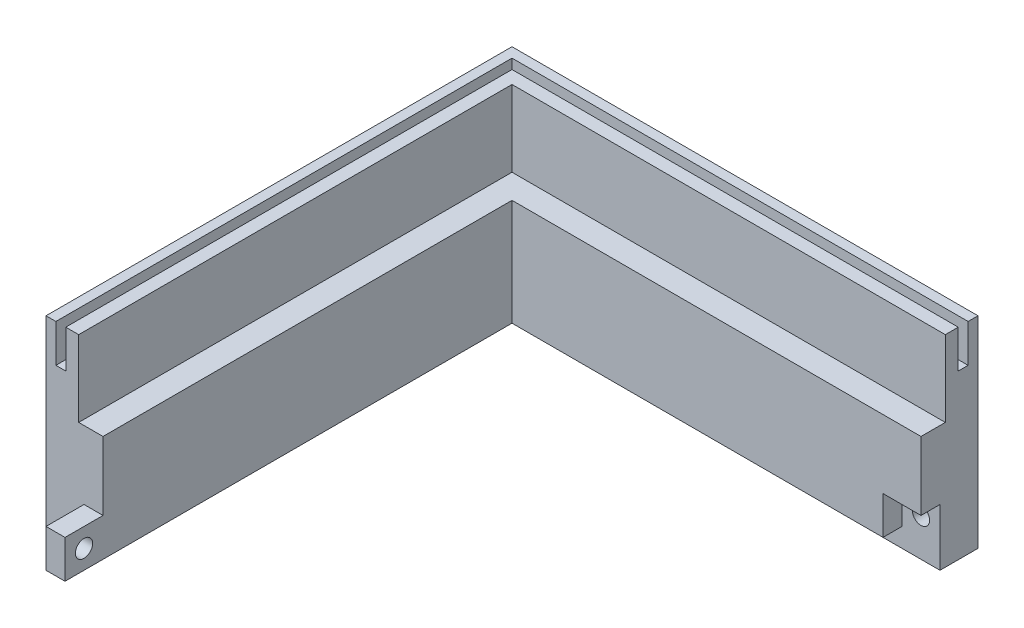
from build123d import *

# Parameters (mm, degrees)
BOSS_EXTRUDE5_DEPTH = 67.31
CUT_EXTRUDE2_DEPTH  = 12.693340834
CUT_EXTRUDE3_DEPTH  = 25.4
CUT_EXTRUDE5_DEPTH  = 6.35
SKETCH16_W          = 6.35
SKETCH16_H          = 12.7
BOSS_EXTRUDE6_DEPTH = 12.7
SKETCH17_W          = 6.35
SKETCH17_H          = 12.7
CUT_EXTRUDE6_DEPTH  = 12.7
SKETCH18_R          = 2.8829
CUT_EXTRUDE7_DEPTH  = 12.7
SKETCH19_R          = 2.8829
CUT_EXTRUDE8_DEPTH  = 4.826
SKETCH21_R          = 2.8829
CUT_EXTRUDE9_DEPTH  = 4.826


with BuildPart() as part:
    # Sketch1 → Boss-Extrude5 (new body)
    with BuildSketch(Plane(origin=(0, 0, 0), x_dir=(1, 0, 0), z_dir=(0, 1, 0))):
        Polygon((-60.605605599, 37.663504972), (95.096394401, 37.663504972), (95.096394401, 18.613504972), (-41.555605599, 18.613504972), (-41.555605599, -118.038495028), (-60.605605599, -118.038495028), align=None)
    extrude(amount=BOSS_EXTRUDE5_DEPTH)

    # Sketch8 → Cut-Extrude2 (cut)
    with BuildSketch(Plane(origin=(0, 67.31, 0), x_dir=(1, 0, 0), z_dir=(0, 1, 0))):
        Polygon((-57.303605599, -118.038495028), (-57.303605599, 34.361504972), (95.096394401, 34.361504972), (95.096394401, 31.059504972), (-54.001605599, 31.059504972), (-54.001605599, -118.038495028), align=None)
    extrude(amount=-CUT_EXTRUDE2_DEPTH, mode=Mode.SUBTRACT)

    # Sketch9 → Cut-Extrude3 (cut)
    with BuildSketch(Plane(origin=(0, 67.31, 0), x_dir=(1, 0, 0), z_dir=(0, 1, 0))):
        Polygon((-49.683605599, -118.038495028), (-49.683605599, 26.741504972), (95.096394401, 26.741504972), (95.096394401, 18.613504972), (-41.555605599, 18.613504972), (-41.555605599, -118.038495028), align=None)
    extrude(amount=-CUT_EXTRUDE3_DEPTH, mode=Mode.SUBTRACT)

    # Sketch15 → Cut-Extrude5 (cut)
    with BuildSketch(Plane.XZ):
        Polygon((-41.555605599, 118.038495028), (-47.905605599, 118.038495028), (-47.905605599, -24.963504972), (95.096394401, -24.963504972), (95.096394401, -18.613504972), (-41.555605599, -18.613504972), align=None)
    extrude(amount=-CUT_EXTRUDE5_DEPTH, mode=Mode.SUBTRACT)

    # Sketch16 → Boss-Extrude6 (add)
    with BuildSketch(Plane.XY.offset(118.038495028)):
        with Locations((-44.730605599, 12.7)):
            Rectangle(SKETCH16_W, SKETCH16_H)
    extrude(amount=BOSS_EXTRUDE6_DEPTH)

    # Sketch17 → Cut-Extrude6 (cut)
    with BuildSketch(Plane(origin=(95.096394401, 0, 0), x_dir=(0, 0, -1), z_dir=(1, 0, 0))):
        with Locations((21.788504972, 12.7)):
            Rectangle(SKETCH17_W, SKETCH17_H)
    extrude(amount=-CUT_EXTRUDE6_DEPTH, mode=Mode.SUBTRACT)

    # Sketch18 → Cut-Extrude7 (cut)
    with BuildSketch(Plane(origin=(-41.555605599, 0, 0), x_dir=(0, 0, -1), z_dir=(1, 0, 0))):
        with Locations((-124.388495028, 12.7)):
            Circle(SKETCH18_R)
    extrude(amount=-CUT_EXTRUDE7_DEPTH, mode=Mode.SUBTRACT)

    # Sketch19 → Cut-Extrude8 (cut)
    with BuildSketch(Plane.XY.offset(-24.963504972)):
        with Locations((88.746394401, 12.7)):
            Circle(SKETCH19_R)
    extrude(amount=-CUT_EXTRUDE8_DEPTH, mode=Mode.SUBTRACT)

    # Sketch21 → Cut-Extrude9 (cut)
    with BuildSketch(Plane.XZ.offset(-6.35)):
        with Locations((-44.730605599, -21.788504972)):
            Circle(SKETCH21_R)
    extrude(amount=-CUT_EXTRUDE9_DEPTH, mode=Mode.SUBTRACT)


solid = part.part
